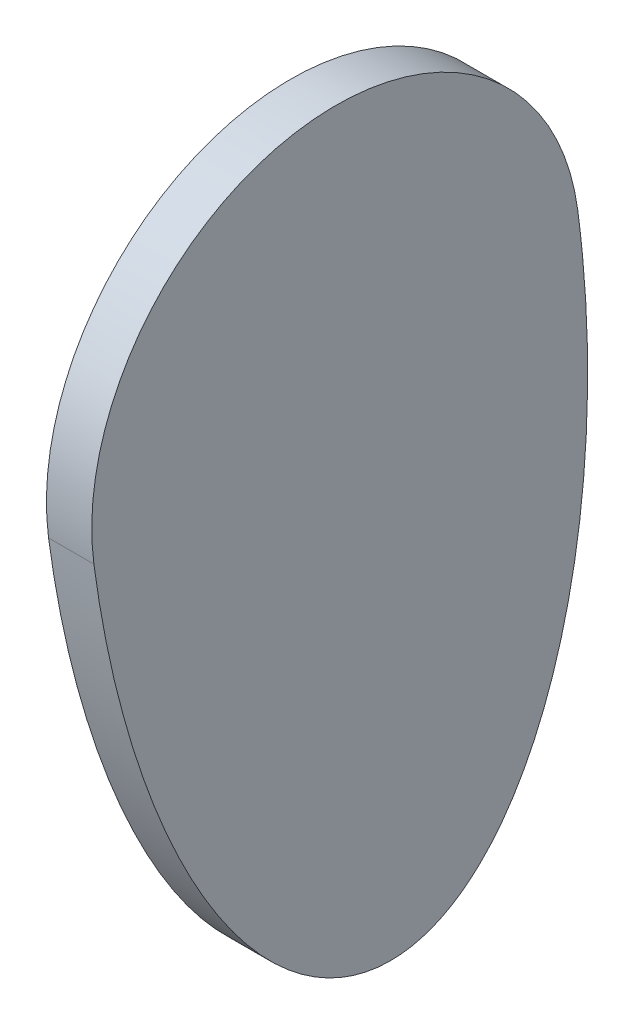
from build123d import *

# Parameters (mm, degrees)
RESSALTO_EXTRUS_O11_DEPTH = 13
ESBO_O44_R                = 20
RESSALTO_EXTRUS_O12_DEPTH = 12


with BuildPart() as part:
    # Esboço43 → Ressalto-extrusão11 (new body)
    with BuildSketch(Plane(origin=(0, 0, 0), x_dir=(0, 0, -1), z_dir=(1, 0, 0))):
        with BuildLine():
            ThreePointArc((69.385953048, 9.251460406), (-9.251460406, 69.385953048), (-69.385953048, -9.251460406))
            add(Edge.make_bspline(
                [(-69.385953048, -9.251460406), (-49.385953048, -159.251460406), (20, -150), (89.385953048, -140.748539594), (69.385953048, 9.251460406)],
                knots=[4.71238898, 4.71238898, 4.71238898, 6.283185307, 6.283185307, 7.853981634, 7.853981634, 7.853981634], degree=2, weights=[1, 0.707106781, 1, 0.707106781, 1]))
        make_face()
    extrude(amount=RESSALTO_EXTRUS_O11_DEPTH)

    # Esboço44 → Ressalto-extrusão12 (add)
    with BuildSketch(Plane(origin=(0, 0, 0), x_dir=(0, 0, -1), z_dir=(1, 0, 0))):
        with Locations((-5, 28.000002978)):
            Circle(ESBO_O44_R)
    extrude(amount=-RESSALTO_EXTRUS_O12_DEPTH)


solid = part.part
